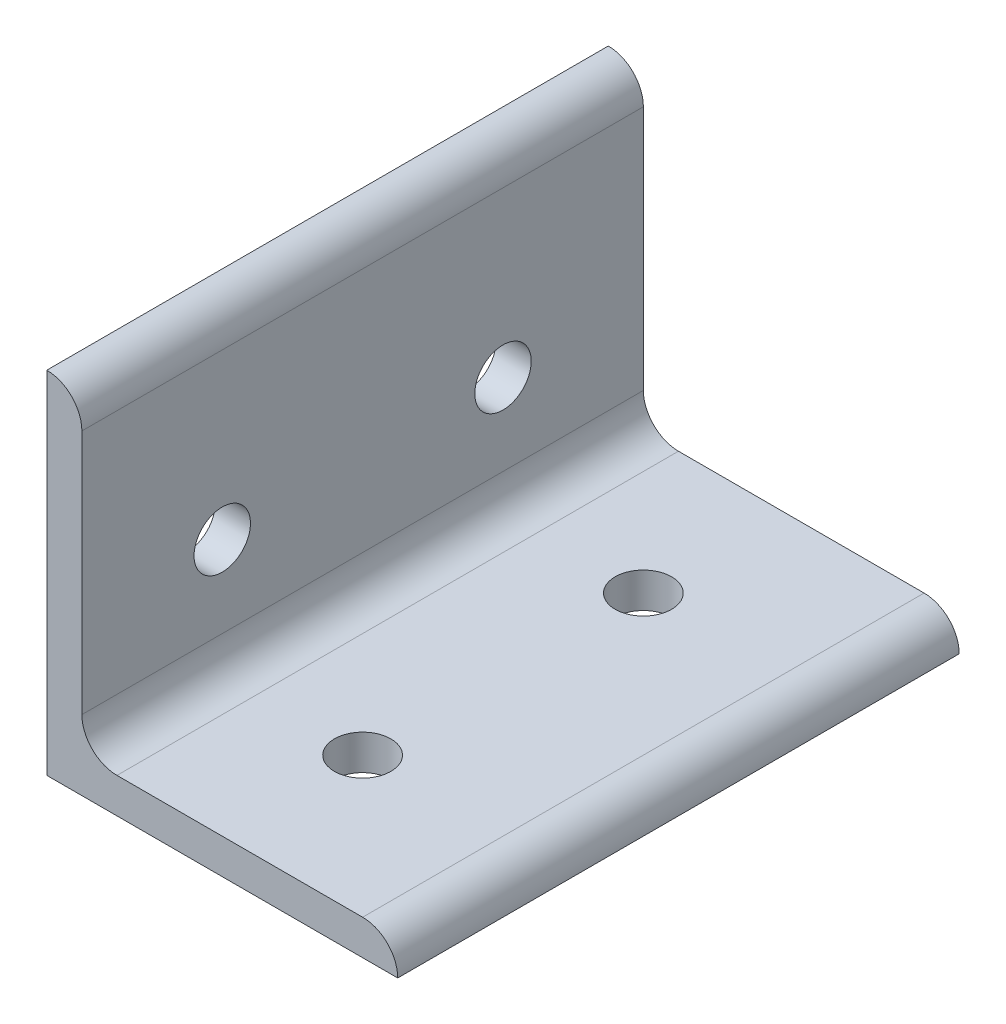
from build123d import *

# Parameters (mm, degrees)
BOSS_EXTRUDE1_DEPTH = 25.4
SKETCH2_R           = 2.5527
CUT_EXTRUDE1_DEPTH  = 52.587643869
SKETCH3_R           = 2.5527
CUT_EXTRUDE2_DEPTH  = 52.587643869
FILLET1_R           = 3.175


with BuildPart() as part:
    # Sketch1 → Boss-Extrude1 (new, symmetric)
    with BuildSketch(Plane.XY):
        Polygon((0, 0), (0, 31.75), (3.175, 31.75), (3.175, 3.175), (31.75, 3.175), (31.75, 0), align=None)
    extrude(amount=BOSS_EXTRUDE1_DEPTH, both=True)

    # Sketch2 → Cut-Extrude1 (cut, through all)
    with BuildSketch(Plane.ZY):
        with Locations((-12.7, 13.716)):
            Circle(SKETCH2_R)
        with Locations((12.7, 13.716)):
            Circle(SKETCH2_R)
    extrude(amount=-CUT_EXTRUDE1_DEPTH, mode=Mode.SUBTRACT)

    # Sketch3 → Cut-Extrude2 (cut, through all)
    with BuildSketch(Plane.XZ):
        with Locations(Location((15.875, 12.7, 0), (0, 0, 270))):
            Circle(SKETCH3_R)
        with Locations(Location((15.875, -12.7, 0), (0, 0, 270))):
            Circle(SKETCH3_R)
    extrude(amount=-CUT_EXTRUDE2_DEPTH, mode=Mode.SUBTRACT)

    # Fillet1
    fillet1_edges = [part.edges().sort_by_distance(p)[0] for p in [
        (3.175, 31.75, 0),
        (31.75, 3.175, 0),
        (3.175, 3.175, 0),
    ]]
    fillet(fillet1_edges, radius=FILLET1_R - 0.0001)  # a hair under: the kernel refuses the full size


solid = part.part
